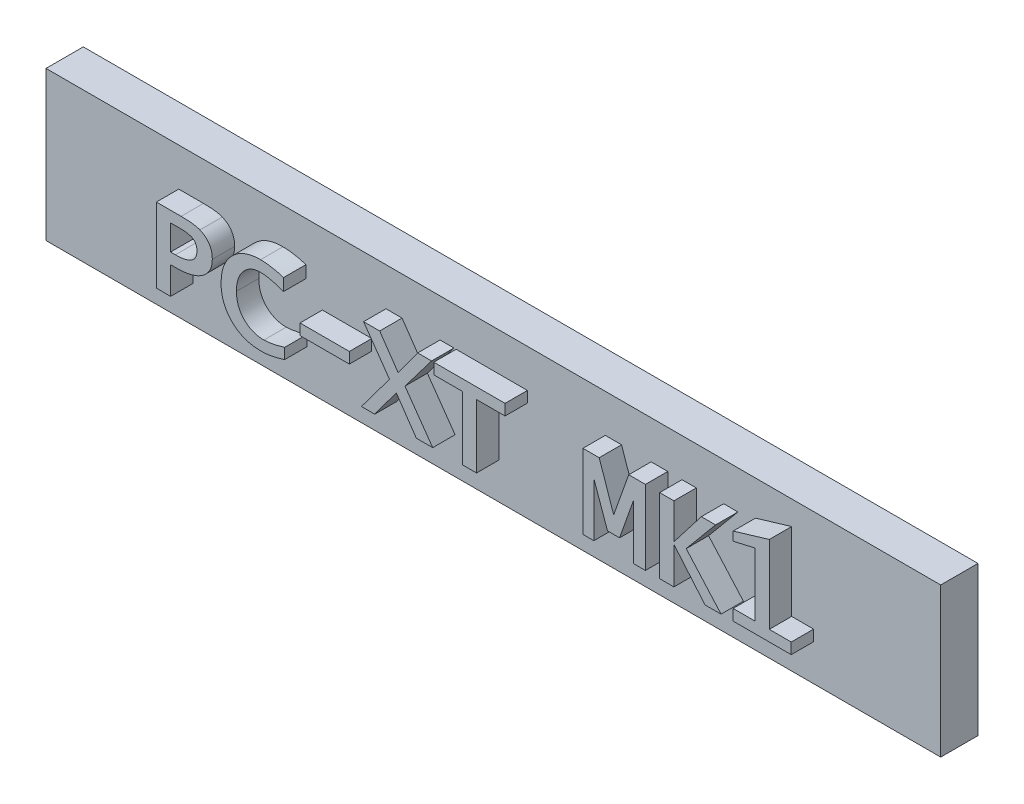
from build123d import *

# Parameters (mm, degrees)
SKETCH1_W               = 120
SKETCH1_H               = 20
BOSS_EXTRUDE1_DEPTH     = 5
BOSS_EXTRUDE2_OUTLINE_W = 6.617647058
BOSS_EXTRUDE2_OUTLINE_H = 1.470588235
BOSS_EXTRUDE2_DEPTH     = 3


# Read off the part's stored shape, not the designer's step: Boss-Extrude2
with BuildPart() as part:
    # Sketch1 → Boss-Extrude1 (new body)
    with BuildSketch(Plane.XY):
        with Locations((60, 10)):
            Rectangle(SKETCH1_W, SKETCH1_H)
    extrude(amount=BOSS_EXTRUDE1_DEPTH)

    # Boss-Extrude2 outline → Boss-Extrude2 (add)
    # profile 1 of 8: a face of its own
    with BuildSketch(Plane.XY.offset(5)):
        with BuildLine():
            add(Edge.make_bspline(
                [(25.303796343, 11.973967774), (25.299856233, 11.847330564), (25.292121626, 11.598736275), (25.23022528, 11.235712232), (25.133476842, 10.89118643), (24.989628622, 10.56827492), (24.811203237, 10.263744314), (24.589299144, 9.980425855), (24.327443028, 9.71821455), (24.029064968, 9.47515755), (23.695277706, 9.256490095), (23.32878062, 9.06884075), (22.933067935, 8.910334992), (22.508375399, 8.778568219), (22.052956031, 8.67956651), (21.568048824, 8.605658716), (21.053688909, 8.561880432), (20.700633888, 8.557231463), (20.51978899, 8.554850127)],
                knots=[0, 0, 0, 0, 0.057519276, 0.112912814, 0.166893936, 0.219731704, 0.27310109, 0.326923741, 0.382796413, 0.441183331, 0.501523512, 0.56379558, 0.627981032, 0.695031311, 0.765633231, 0.839574716, 0.917825573, 1, 1, 1, 1], degree=3))
            add(Edge.make_bspline(
                [(23.647086784, 14.561283951), (23.778516824, 14.499018001), (24.032995088, 14.378457049), (24.372903096, 14.14255678), (24.662080963, 13.871513214), (24.89985768, 13.562418237), (25.082981356, 13.215602249), (25.211149288, 12.832993338), (25.291338521, 12.415417246), (25.299549076, 12.124471905), (25.303796343, 11.973967774)],
                knots=[0, 0, 0, 0, 0.132911897, 0.257347475, 0.376844556, 0.494326518, 0.612535969, 0.734004634, 0.862402329, 1, 1, 1, 1], degree=3))
            add(Edge.make_bspline(
                [(21.119513255, 14.878379539), (21.26199974, 14.877858991), (21.537114755, 14.876853908), (21.933127189, 14.859109297), (22.298074681, 14.837987475), (22.63017945, 14.804379738), (22.930644762, 14.758103784), (23.198553417, 14.704101434), (23.435652241, 14.641144547), (23.57928391, 14.586893664), (23.647086784, 14.561283951)],
                knots=[0, 0, 0, 0, 0.166891759, 0.322237078, 0.464280796, 0.595071329, 0.713081624, 0.82024163, 0.915143129, 1, 1, 1, 1], degree=3))
            Line((21.119513255, 14.878379539), (17.803796343, 14.878379539))
            Line((17.803796343, 14.878379539), (17.803796343, 4.878379539))
            Line((17.803796343, 4.878379539), (19.715561049, 4.878379539))
            Line((19.715561049, 4.878379539), (19.715561049, 8.554850127))
            Line((19.715561049, 8.554850127), (20.51978899, 8.554850127))
        make_face()
        with BuildLine():
            add(Edge.make_bspline(
                [(20.354347814, 10.025438363), (20.470818041, 10.026440203), (20.697108437, 10.028386681), (21.02522415, 10.05254799), (21.330930259, 10.087239288), (21.613097903, 10.141118226), (21.873975808, 10.206520767), (22.112376076, 10.288653511), (22.32895713, 10.385575911), (22.522102636, 10.497287101), (22.692678357, 10.625332972), (22.840208216, 10.768032644), (22.966645703, 10.925691083), (23.067037892, 11.100058018), (23.149980693, 11.287232974), (23.202670647, 11.491493432), (23.239208925, 11.709178543), (23.243013184, 11.859678392), (23.244972814, 11.937203069)],
                knots=[0, 0, 0, 0, 0.088929398, 0.172781227, 0.251140234, 0.323760993, 0.392002131, 0.456378299, 0.516068787, 0.57295328, 0.626417647, 0.678540411, 0.729333295, 0.780196862, 0.831811679, 0.885167137, 0.940847911, 1, 1, 1, 1], degree=3))
            Line((20.354347814, 10.025438363), (19.715561049, 10.025438363))
            Line((19.715561049, 10.025438363), (19.715561049, 13.407791304))
            Line((19.715561049, 13.407791304), (20.91041399, 13.407791304))
            add(Edge.make_bspline(
                [(23.244972814, 11.937203069), (23.242827384, 12.000052654), (23.238652838, 12.122344472), (23.217440042, 12.299255096), (23.174732012, 12.462318198), (23.118543777, 12.611949665), (23.043903543, 12.747124827), (22.952862536, 12.868728049), (22.845227109, 12.976186082), (22.719912513, 13.070349365), (22.574905291, 13.151907261), (22.405811585, 13.219069984), (22.214758208, 13.27907147), (21.999490586, 13.326880315), (21.760551173, 13.362148575), (21.498435025, 13.389998758), (21.212389406, 13.405902213), (21.01383448, 13.407144328), (20.91041399, 13.407791304)],
                knots=[0, 0, 0, 0, 0.059608489, 0.115985339, 0.168463638, 0.219028524, 0.267124802, 0.314319317, 0.362579728, 0.410790958, 0.46248486, 0.519789175, 0.582940524, 0.652165068, 0.728564689, 0.811793913, 0.901969868, 1, 1, 1, 1], degree=3))
        make_face(mode=Mode.SUBTRACT)
    # profile 2 of 8: a face of its own
    with BuildSketch(Plane.XY.offset(5)):
        with BuildLine():
            add(Edge.make_bspline(
                [(32.220156637, 6.054850127), (32.310592321, 6.056885466), (32.498669656, 6.061118322), (32.79145487, 6.088585676), (33.107018646, 6.128461886), (33.444067168, 6.193773696), (33.804967956, 6.267492835), (34.186635485, 6.363936802), (34.59169158, 6.473115371), (34.867465278, 6.557967719), (35.009678696, 6.601725127)],
                knots=[0, 0, 0, 0, 0.095118222, 0.19781552, 0.309134552, 0.429542312, 0.558789092, 0.696541354, 0.843509763, 1, 1, 1, 1], degree=3))
            add(Edge.make_bspline(
                [(28.539090461, 9.878379539), (28.541711472, 9.737261634), (28.546828975, 9.461730069), (28.600394222, 9.060064565), (28.678322081, 8.678452199), (28.794729827, 8.318685066), (28.940603815, 7.978482718), (29.124918848, 7.663042088), (29.335860348, 7.365694209), (29.583119512, 7.096511993), (29.851516351, 6.851511376), (30.140858986, 6.639066035), (30.445991714, 6.457924978), (30.76845685, 6.311474618), (31.107523075, 6.194803356), (31.463266083, 6.113019971), (31.836564714, 6.063647376), (32.090560805, 6.057822262), (32.220156637, 6.054850127)],
                knots=[0, 0, 0, 0, 0.07098112, 0.138590061, 0.203610831, 0.266760323, 0.328564777, 0.389527986, 0.450293432, 0.511697462, 0.573101493, 0.63293168, 0.692035943, 0.751376073, 0.810866267, 0.872207344, 0.934796651, 1, 1, 1, 1], degree=3))
            add(Edge.make_bspline(
                [(31.735322078, 13.701908951), (31.625584655, 13.699108591), (31.408737755, 13.693574933), (31.090657145, 13.640853265), (30.785342766, 13.55865927), (30.493615649, 13.442169687), (30.213712019, 13.295080321), (29.948829262, 13.111688073), (29.696631327, 12.895848765), (29.460016249, 12.649927244), (29.244153927, 12.376947596), (29.055311222, 12.081171567), (28.892793351, 11.765877447), (28.765147295, 11.427499787), (28.663490759, 11.069317075), (28.590800528, 10.6903702), (28.54601758, 10.290765264), (28.541434072, 10.017899565), (28.539090461, 9.878379539)],
                knots=[0, 0, 0, 0, 0.059060866, 0.116707367, 0.173148665, 0.229068973, 0.285535893, 0.343090809, 0.402197758, 0.464048116, 0.526605656, 0.589313988, 0.652778949, 0.71728512, 0.783751921, 0.853085817, 0.924880735, 1, 1, 1, 1], degree=3))
            add(Edge.make_bspline(
                [(34.862619873, 13.010272921), (34.712094702, 13.065678344), (34.418810435, 13.173630647), (33.983605771, 13.314522863), (33.565135176, 13.43044601), (33.165866768, 13.53108072), (32.783287266, 13.607760654), (32.418070154, 13.660024649), (32.070681059, 13.694288596), (31.844922777, 13.699418497), (31.735322078, 13.701908951)],
                knots=[0, 0, 0, 0, 0.149479484, 0.291246845, 0.426168889, 0.554112428, 0.674927524, 0.789608346, 0.897859462, 1, 1, 1, 1], degree=3))
            Line((34.862619873, 13.010272921), (34.862619873, 14.637111157))
            add(Edge.make_bspline(
                [(31.778980167, 15.172497186), (31.894679859, 15.1705268), (32.129401081, 15.166529457), (32.487377781, 15.139782836), (32.856058151, 15.098572469), (33.236434368, 15.041266522), (33.627014422, 14.964456285), (34.029220179, 14.872171214), (34.443530604, 14.765070269), (34.721221899, 14.680283723), (34.862619873, 14.637111157)],
                knots=[0, 0, 0, 0, 0.110495315, 0.224163046, 0.342668376, 0.464743505, 0.591419868, 0.722733876, 0.858818519, 1, 1, 1, 1], degree=3))
            add(Edge.make_bspline(
                [(26.480266931, 9.827828069), (26.484500225, 10.02181755), (26.492793977, 10.401876342), (26.563004621, 10.957233948), (26.677797648, 11.484977757), (26.837976069, 11.98510086), (27.045964895, 12.45599245), (27.298319587, 12.899402679), (27.597900516, 13.313963203), (27.942546384, 13.696330394), (28.322316959, 14.042599219), (28.733421236, 14.345571274), (29.172580126, 14.601706675), (29.6394515, 14.813092465), (30.135949277, 14.971797037), (30.658359702, 15.090617605), (31.209565466, 15.159743784), (31.586538987, 15.168187006), (31.778980167, 15.172497186)],
                knots=[0, 0, 0, 0, 0.068733458, 0.134660677, 0.198024765, 0.259921027, 0.320449091, 0.380147234, 0.440421531, 0.501357899, 0.562274914, 0.622270424, 0.682004971, 0.742147694, 0.803527478, 0.86642055, 0.931809039, 1, 1, 1, 1], degree=3))
            add(Edge.make_bspline(
                [(31.850211784, 4.584261892), (31.653948922, 4.58871722), (31.269449993, 4.597445661), (30.7079199, 4.664439905), (30.175485876, 4.776833822), (29.671834911, 4.935515825), (29.19702029, 5.140738505), (28.750212296, 5.389551528), (28.335118795, 5.685812736), (27.951350518, 6.023454583), (27.605474472, 6.397981049), (27.30549491, 6.805992941), (27.047870518, 7.238942268), (26.841216385, 7.703159724), (26.67663073, 8.193686374), (26.563520081, 8.713814328), (26.492565053, 9.261368069), (26.484429012, 9.636119741), (26.480266931, 9.827828069)],
                knots=[0, 0, 0, 0, 0.069653702, 0.136458694, 0.200393837, 0.262561094, 0.323571382, 0.383700565, 0.443750405, 0.504238092, 0.564847248, 0.624335619, 0.683692757, 0.743320132, 0.804362517, 0.867027168, 0.93197629, 1, 1, 1, 1], degree=3))
            add(Edge.make_bspline(
                [(35.009678696, 5.179390569), (34.866846723, 5.131381768), (34.585868735, 5.036939216), (34.164054719, 4.919516247), (33.754147919, 4.813950078), (33.353343773, 4.732996198), (32.963852787, 4.663613513), (32.583235903, 4.619125234), (32.212961282, 4.589759114), (31.969750639, 4.586073422), (31.850211784, 4.584261892)],
                knots=[0, 0, 0, 0, 0.139961964, 0.275332129, 0.406664334, 0.533097703, 0.655108735, 0.774081672, 0.888960376, 1, 1, 1, 1], degree=3))
            Line((35.009678696, 5.179390569), (35.009678696, 6.601725127))
        make_face()
    # profile 3 of 8: a face of its own
    with BuildSketch(Plane.XY.offset(5)):
        Polygon((49.069880902, 9.926633216), (45.303796343, 4.878379539), (47.089182373, 4.878379539), (49.97291399, 8.803011892), (52.679715461, 4.878379539), (54.862619873, 4.878379539), (51.147086784, 10.167901598), (54.715561049, 14.878379539), (52.849752226, 14.878379539), (50.218777961, 11.286927333), (47.753244873, 14.878379539), (45.59791399, 14.878379539), align=None)
    # profile 4 of 8: a face of its own
    with BuildSketch(Plane.XY.offset(5)):
        Polygon((58.833208108, 13.407791304), (58.833208108, 4.878379539), (60.744972814, 4.878379539), (60.744972814, 13.407791304), (64.568502226, 13.407791304), (64.568502226, 14.878379539), (55.009678696, 14.878379539), (55.009678696, 13.407791304), align=None)
    # profile 5 of 8: a face of its own
    with BuildSketch(Plane.XY.offset(5)):
        Polygon((75.009678696, 14.878379539), (75.009678696, 4.878379539), (76.480266931, 4.878379539), (76.480266931, 12.097230962), (78.307013255, 6.937203069), (79.929255902, 6.937203069), (81.774384578, 12.155188725), (81.774384578, 4.878379539), (83.392031637, 4.878379539), (83.392031637, 14.878379539), (81.156277961, 14.878379539), (79.135654132, 9.209285904), (77.192583108, 14.878379539), align=None)
    # profile 6 of 8: a face of its own
    with BuildSketch(Plane.XY.offset(5)):
        Polygon((85.303796343, 14.878379539), (85.303796343, 4.878379539), (87.215561049, 4.878379539), (87.215561049, 9.825530274), (91.386057373, 4.878379539), (93.539090461, 4.878379539), (88.865377226, 10.156412627), (92.803796343, 14.878379539), (90.892031637, 14.878379539), (87.215561049, 10.119647921), (87.215561049, 14.878379539), align=None)
    # profile 7 of 8: a face of its own
    with BuildSketch(Plane.XY.offset(5)):
        Polygon((95.15673752, 6.348967774), (95.15673752, 4.878379539), (102.950855167, 4.878379539), (102.950855167, 6.348967774), (100.009678696, 6.348967774), (100.009678696, 16.790144245), (95.15673752, 15.340236157), (95.15673752, 14.15916998), (98.09791399, 14.837019245), (98.09791399, 6.348967774), align=None)
    # profile 8 of 8: a face of its own
    with BuildSketch(Plane.XY.offset(5)):
        with Locations((40.377325755, 9.731320716)):
            Rectangle(BOSS_EXTRUDE2_OUTLINE_W, BOSS_EXTRUDE2_OUTLINE_H)
    extrude(amount=BOSS_EXTRUDE2_DEPTH)


solid = part.part
